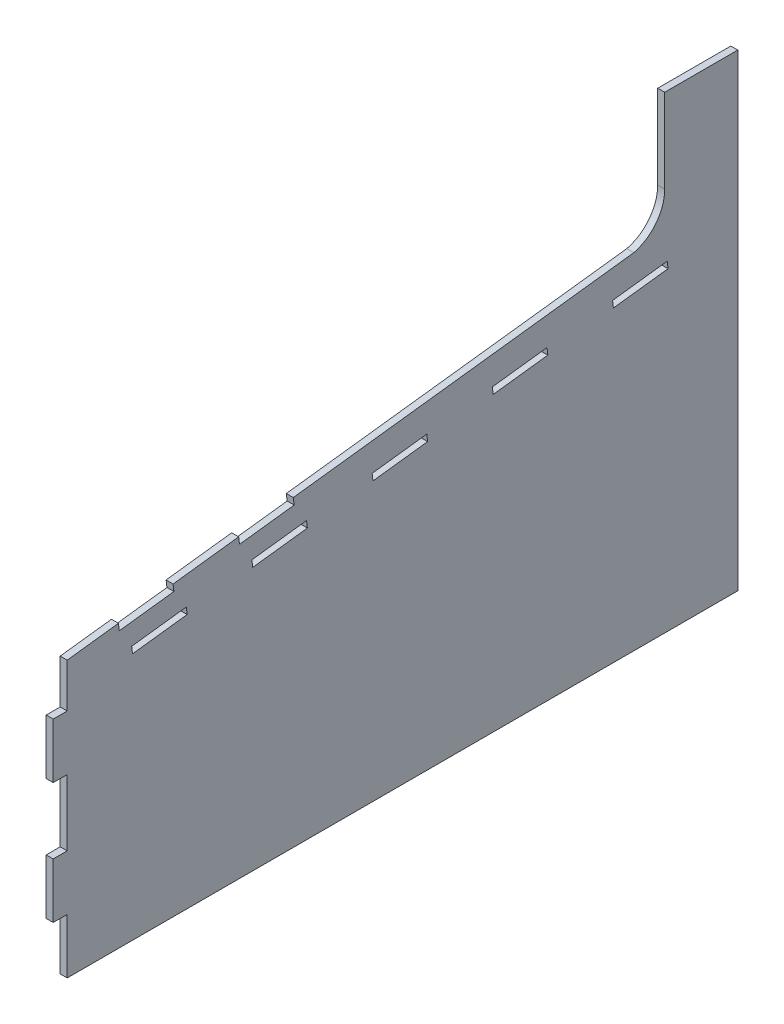
from build123d import *

# Parameters (mm, degrees)
BOSS_EXTRUDE1_DEPTH = 6.35
CUT_EXTRUDE1_DEPTH  = 6.35


with BuildPart() as part:
    # Sketch1 → Boss-Extrude1 (new body)
    with BuildSketch(Plane(origin=(0, 0, 0), x_dir=(0, 0, -1), z_dir=(1, 0, 0))):
        with BuildLine():
            Line((0, 0), (609, 0))
            Line((609, 0), (609, 250))
            Line((609, 250), (609, 425.32))
            Line((609, 425.32), (542.65, 425.32))
            Line((542.65, 425.32), (542.65, 349.09))
            ThreePointArc((542.65, 349.09), (534.796363904, 326.297688332), (514.569488044, 313.181188643))
            Line((514.569488044, 313.181188643), (0, 250))
            Line((0, 250), (0, 210))
            Line((0, 210), (-12.7, 210))
            Line((-12.7, 210), (-12.7, 160))
            Line((-12.7, 160), (0, 160))
            Line((0, 160), (0, 100))
            Line((0, 100), (-12.7, 100))
            Line((-12.7, 100), (-12.7, 50))
            Line((-12.7, 50), (0, 50))
            Line((0, 50), (0, 0))
        make_face()
    extrude(amount=BOSS_EXTRUDE1_DEPTH)

    # Sketch2 → Cut-Extrude1 (cut)
    with BuildSketch(Plane(origin=(6.35, 0, 0), x_dir=(0, 0, -1), z_dir=(1, 0, 0))):
        Polygon((205.339210522, 275.2124848), (155.71190294, 269.11901763), (156.485773271, 262.816349567), (206.113080853, 268.909816737), align=None)
        Polygon((58.560222947, 231.599541694), (59.334093277, 225.296873631), (108.96140086, 231.390340802), (108.187530529, 237.693008865), align=None)
        Polygon((217.367607209, 251.098636639), (167.740299627, 245.005169469), (168.514169958, 238.702501406), (218.14147754, 244.795968576), align=None)
        Polygon((326.54768389, 264.504264414), (276.920376308, 258.410797243), (277.694246639, 252.10812918), (327.321554221, 258.201596351), align=None)
        Polygon((435.727760571, 277.909892188), (386.100452988, 271.816425018), (386.874323319, 265.513756955), (436.501630901, 271.607224125), align=None)
        Polygon((544.907837251, 291.315519963), (495.280529669, 285.222052793), (496.0544, 278.91938473), (545.681707582, 285.0128519), align=None)
        Polygon((46.53182626, 255.713389855), (47.30569659, 249.410721792), (96.933004172, 255.504188963), (96.159133842, 261.806857026), align=None)
    extrude(amount=-CUT_EXTRUDE1_DEPTH, mode=Mode.SUBTRACT)


solid = part.part
